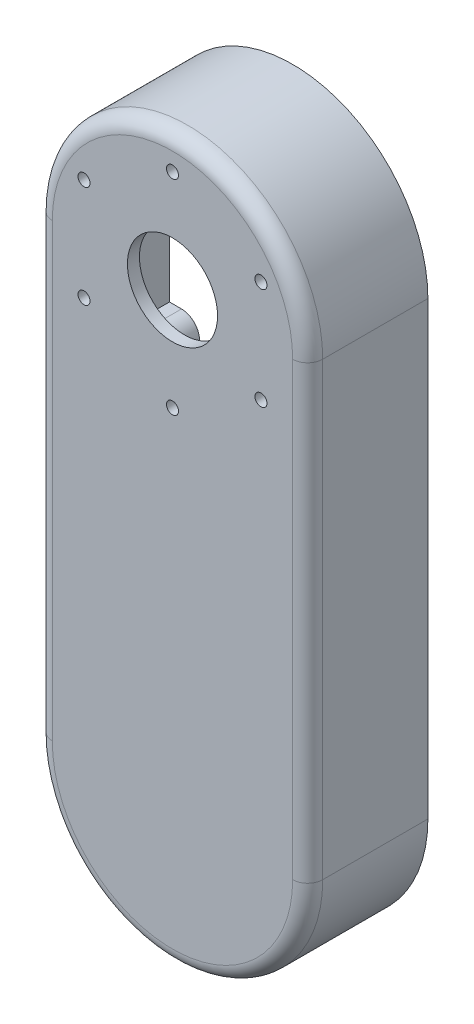
from build123d import *

# Parameters (mm, degrees)
ESBO_O1_R                = 2
ESBO_O1_R_2              = 15
RESSALTO_EXTRUS_O1_DEPTH = 40
CASCA1_T                 = -4
ESBO_O2_R                = 2
RESSALTO_EXTRUS_O3_DEPTH = 36
CORTE_EXTRUS_O2_DEPTH    = 4
RESSALTO_EXTRUS_O4_DEPTH = 4
FILETE1_START            = 49
FILETE1_DEPTH            = 6
FILETE1_START_2          = 50
FILETE1_2_DEPTH          = 4
PADR_O_LINEAR1_COUNT     = 2
PADR_O_LINEAR1_PITCH     = 40
CHANFRO1_SIZE            = 8
CHANFRO1_SIZE2           = 13.856406461
FILETE2_R                = 5


with BuildPart() as part:
    # Esboço1 → Ressalto-extrusão1 (new body)
    with BuildSketch(Plane.XY):
        with BuildLine():
            Line((-45, 150), (-45, 0))
            ThreePointArc((-45, 0), (0, -45), (45, 0))
            Line((45, 0), (45, 150))
            ThreePointArc((45, 150), (0, 195), (-45, 150))
        make_face()
        with Locations((0, 184)):
            Circle(ESBO_O1_R, mode=Mode.SUBTRACT)
        with Locations((29.444863729, 167)):
            Circle(ESBO_O1_R, mode=Mode.SUBTRACT)
        with Locations((29.444863729, 133)):
            Circle(ESBO_O1_R, mode=Mode.SUBTRACT)
        with Locations((0, 116)):
            Circle(ESBO_O1_R, mode=Mode.SUBTRACT)
        with Locations((-29.444863729, 133)):
            Circle(ESBO_O1_R, mode=Mode.SUBTRACT)
        with Locations((-29.444863729, 167)):
            Circle(ESBO_O1_R, mode=Mode.SUBTRACT)
        with Locations((0, 150)):
            Circle(ESBO_O1_R_2, mode=Mode.SUBTRACT)
    extrude(amount=RESSALTO_EXTRUS_O1_DEPTH)

    # Casca1
    casca1_openings = [part.faces().sort_by_distance(p)[0] for p in [
        (-2, 184, 20),
        (-15, 150, 20),
        (27.444863729, 167, 20),
        (27.444863729, 133, 20),
        (-2, 116, 20),
        (-31.444863729, 133, 20),
        (0, 71.925006446, 0),
        (-31.444863729, 167, 20),
    ]]
    offset(amount=CASCA1_T, openings=casca1_openings, kind=Kind.INTERSECTION)

    # Esboço2 → Ressalto-extrusão3 (add)
    # profile 1 of 12: a face of its own
    with BuildSketch(Plane(origin=(0, 0, 36), x_dir=(-1, 0, 0), z_dir=(0, 0, -1))):
        with BuildLine():
            Line((41.3, 156), (41.3, 144))
            Line((41.3, 144), (37, 144))
            ThreePointArc((37, 144), (31, 150), (37, 156))
            Line((37, 156), (41.3, 156))
        make_face()
        with Locations(Location((37, 150, 0), (0, 0, 180))):
            Circle(ESBO_O2_R, mode=Mode.SUBTRACT)
    # profile 2 of 12: a face of its own
    with BuildSketch(Plane(origin=(0, 0, 36), x_dir=(-1, 0, 0), z_dir=(0, 0, -1))):
        with BuildLine():
            Line((37, 94), (41.3, 94))
            Line((41.3, 94), (41.3, 106))
            Line((41.3, 106), (37, 106))
            ThreePointArc((37, 106), (31, 100), (37, 94))
        make_face()
        with Locations(Location((37, 100, 0), (0, 0, 180))):
            Circle(ESBO_O2_R, mode=Mode.SUBTRACT)
    # profile 3 of 12: a face of its own
    with BuildSketch(Plane(origin=(0, 0, 36), x_dir=(-1, 0, 0), z_dir=(0, 0, -1))):
        with BuildLine():
            Line((37, 44), (41.3, 44))
            Line((41.3, 44), (41.3, 56))
            Line((41.3, 56), (37, 56))
            ThreePointArc((37, 56), (31, 50), (37, 44))
        make_face()
        with Locations(Location((37, 50, 0), (0, 0, 180))):
            Circle(ESBO_O2_R, mode=Mode.SUBTRACT)
    # profile 4 of 12: a face of its own
    with BuildSketch(Plane(origin=(0, 0, 36), x_dir=(-1, 0, 0), z_dir=(0, 0, -1))):
        with BuildLine():
            Line((37, -6), (41.3, -6))
            Line((41.3, -6), (41.3, 6))
            Line((41.3, 6), (37, 6))
            ThreePointArc((37, 6), (31, 0), (37, -6))
        make_face()
        with Locations(Location((37, 0, 0), (0, 0, 180))):
            Circle(ESBO_O2_R, mode=Mode.SUBTRACT)
    # profile 5 of 12: a face of its own
    with BuildSketch(Plane(origin=(0, 0, 36), x_dir=(-1, 0, 0), z_dir=(0, 0, -1))):
        with BuildLine():
            Line((15.577697221, 184.434272947), (17.955996053, 187.650434427))
            Line((17.955996053, 187.650434427), (22.772975647, 184.454050272))
            Line((22.772975647, 184.454050272), (27.779304684, 180.751951801))
            Line((27.779304684, 180.751951801), (27.604480494, 180.515537933))
            Line((27.604480494, 180.515537933), (25.226181662, 177.299376452))
            ThreePointArc((25.226181662, 177.299376452), (16.834491194, 176.042582479), (15.577697221, 184.434272947))
        make_face()
        with Locations(Location((20.401939442, 180.866824699, 0), (0, 0, 180))):
            Circle(ESBO_O2_R, mode=Mode.SUBTRACT)
    # profile 6 of 12: a face of its own
    with BuildSketch(Plane(origin=(0, 0, 36), x_dir=(-1, 0, 0), z_dir=(0, 0, -1))):
        with BuildLine():
            Line((27.779304684, -30.751951801), (27.604480494, -30.515537933))
            Line((27.604480494, -30.515537933), (25.226181662, -27.299376452))
            ThreePointArc((25.226181662, -27.299376452), (16.834491194, -26.042582479), (15.577697221, -34.434272947))
            Line((15.577697221, -34.434272947), (17.955996053, -37.650434427))
            Line((17.955996053, -37.650434427), (22.772975647, -34.454050272))
            Line((22.772975647, -34.454050272), (27.779304684, -30.751951801))
        make_face()
        with Locations(Location((20.401939442, -30.866824699, 0), (0, 0, 180))):
            Circle(ESBO_O2_R, mode=Mode.SUBTRACT)
    # profile 7 of 12: a face of its own
    with BuildSketch(Plane(origin=(0, 0, 36), x_dir=(-1, 0, 0), z_dir=(0, 0, -1))):
        with BuildLine():
            Line((-15.577697221, -34.434272947), (-17.955996053, -37.650434427))
            Line((-17.955996053, -37.650434427), (-22.772975647, -34.454050272))
            Line((-22.772975647, -34.454050272), (-27.779304684, -30.751951801))
            Line((-27.779304684, -30.751951801), (-27.604480494, -30.515537933))
            Line((-27.604480494, -30.515537933), (-25.226181662, -27.299376452))
            ThreePointArc((-25.226181662, -27.299376452), (-16.834491194, -26.042582479), (-15.577697221, -34.434272947))
        make_face()
        with Locations(Location((-20.401939442, -30.866824699, 0), (0, 0, 180))):
            Circle(ESBO_O2_R, mode=Mode.SUBTRACT)
    # profile 8 of 12: a face of its own
    with BuildSketch(Plane(origin=(0, 0, 36), x_dir=(-1, 0, 0), z_dir=(0, 0, -1))):
        with BuildLine():
            Line((-27.779304684, 180.751951801), (-27.604480494, 180.515537933))
            Line((-27.604480494, 180.515537933), (-25.226181662, 177.299376452))
            ThreePointArc((-25.226181662, 177.299376452), (-16.834491194, 176.042582479), (-15.577697221, 184.434272947))
            Line((-15.577697221, 184.434272947), (-17.955996053, 187.650434427))
            Line((-17.955996053, 187.650434427), (-22.772975647, 184.454050272))
            Line((-22.772975647, 184.454050272), (-27.779304684, 180.751951801))
        make_face()
        with Locations(Location((-20.401939442, 180.866824699, 0), (0, 0, 180))):
            Circle(ESBO_O2_R, mode=Mode.SUBTRACT)
    # profile 9 of 12: a face of its own
    with BuildSketch(Plane(origin=(0, 0, 36), x_dir=(-1, 0, 0), z_dir=(0, 0, -1))):
        with BuildLine():
            Line((-41.3, 6), (-41.3, -6))
            Line((-41.3, -6), (-37, -6))
            ThreePointArc((-37, -6), (-31, 0), (-37, 6))
            Line((-37, 6), (-41.3, 6))
        make_face()
        with Locations(Location((-37, 0, 0), (0, 0, 180))):
            Circle(ESBO_O2_R, mode=Mode.SUBTRACT)
    # profile 10 of 12: a face of its own
    with BuildSketch(Plane(origin=(0, 0, 36), x_dir=(-1, 0, 0), z_dir=(0, 0, -1))):
        with BuildLine():
            Line((-41.3, 56), (-41.3, 44))
            Line((-41.3, 44), (-37, 44))
            ThreePointArc((-37, 44), (-31, 50), (-37, 56))
            Line((-37, 56), (-41.3, 56))
        make_face()
        with Locations(Location((-37, 50, 0), (0, 0, 180))):
            Circle(ESBO_O2_R, mode=Mode.SUBTRACT)
    # profile 11 of 12: a face of its own
    with BuildSketch(Plane(origin=(0, 0, 36), x_dir=(-1, 0, 0), z_dir=(0, 0, -1))):
        with BuildLine():
            Line((-41.3, 106), (-41.3, 94))
            Line((-41.3, 94), (-37, 94))
            ThreePointArc((-37, 94), (-31, 100), (-37, 106))
            Line((-37, 106), (-41.3, 106))
        make_face()
        with Locations(Location((-37, 100, 0), (0, 0, 180))):
            Circle(ESBO_O2_R, mode=Mode.SUBTRACT)
    # profile 12 of 12: a face of its own
    with BuildSketch(Plane(origin=(0, 0, 36), x_dir=(-1, 0, 0), z_dir=(0, 0, -1))):
        with BuildLine():
            Line((-37, 144), (-41.3, 144))
            Line((-41.3, 144), (-41.3, 156))
            Line((-41.3, 156), (-37, 156))
            ThreePointArc((-37, 156), (-31, 150), (-37, 144))
        make_face()
        with Locations(Location((-37, 150, 0), (0, 0, 180))):
            Circle(ESBO_O2_R, mode=Mode.SUBTRACT)
    extrude(amount=RESSALTO_EXTRUS_O3_DEPTH)

    # Esboço3 → Corte-extrusão2 (cut)
    with BuildSketch(Plane(origin=(0, 0, 10), x_dir=(-1, 0, 0), z_dir=(0, 0, -1))):
        Polygon((-39.25166605, 146.1), (-34.74833395, 146.1), (-31, 146.1), (-31, 153.9), (-34.74833395, 153.9), (-39.25166605, 153.9), (-41.5033321, 150), align=None)
        Polygon((-15.927398314, 181.375235656), (-18.604965682, 184.996096464), (-23.079506809, 184.487685507), (-24.876480569, 180.358413743), (-22.198913201, 176.737552935), (-19.955229405, 173.703430685), (-13.683714518, 178.341113406), align=None)
        Polygon((-39.25166605, 96.1), (-34.74833395, 96.1), (-31, 96.1), (-31, 103.9), (-34.74833395, 103.9), (-39.25166605, 103.9), (-41.5033321, 100), align=None)
        Polygon((-39.25166605, 46.1), (-34.74833395, 46.1), (-31, 46.1), (-31, 53.9), (-34.74833395, 53.9), (-39.25166605, 53.9), (-41.5033321, 50), align=None)
        Polygon((-39.25166605, -3.9), (-34.74833395, -3.9), (-31, -3.9), (-31, 3.9), (-34.74833395, 3.9), (-39.25166605, 3.9), (-41.5033321, 0), align=None)
        Polygon((-22.198913201, -26.737552935), (-19.955229405, -23.703430685), (-13.683714518, -28.341113406), (-15.927398314, -31.375235656), (-18.604965682, -34.996096464), (-23.079506809, -34.487685507), (-24.876480569, -30.358413743), align=None)
        Polygon((15.927398314, -31.375235656), (18.604965682, -34.996096464), (23.079506809, -34.487685507), (24.876480569, -30.358413743), (22.198913201, -26.737552935), (19.955229405, -23.703430685), (13.683714518, -28.341113406), align=None)
        Polygon((41.5033321, 0), (39.25166605, -3.9), (34.74833395, -3.9), (31, -3.9), (31, 3.9), (34.74833395, 3.9), (39.25166605, 3.9), align=None)
        Polygon((41.5033321, 50), (39.25166605, 46.1), (34.74833395, 46.1), (31, 46.1), (31, 53.9), (34.74833395, 53.9), (39.25166605, 53.9), align=None)
        Polygon((41.5033321, 100), (39.25166605, 96.1), (34.74833395, 96.1), (31, 96.1), (31, 103.9), (34.74833395, 103.9), (39.25166605, 103.9), align=None)
        Polygon((22.198913201, 176.737552935), (19.955229405, 173.703430685), (13.683714518, 178.341113406), (15.927398314, 181.375235656), (18.604965682, 184.996096464), (23.079506809, 184.487685507), (24.876480569, 180.358413743), align=None)
        Polygon((31, 146.1), (34.74833395, 146.1), (39.25166605, 146.1), (41.5033321, 150), (39.25166605, 153.9), (34.74833395, 153.9), (31, 153.9), align=None)
    extrude(amount=-CORTE_EXTRUS_O2_DEPTH, mode=Mode.SUBTRACT)

    # Esboço7 → Ressalto-extrusão4 (add)
    with BuildSketch(Plane(origin=(0, 50, 0), x_dir=(1, 0, 0), z_dir=(0, 1, 0))):
        Polygon((10, -36), (10, -34), (0, -34), (0, -32), (15, -32), (15, -36), align=None)
    ressalto_extrus_o4 = extrude(amount=RESSALTO_EXTRUS_O4_DEPTH)

    # Filete1: read off the stored shape, not the designer's step
    # Filete1 outline → Filete1 (cut)
    with BuildSketch(Plane(origin=(0, 0, 0), x_dir=(1, 0, 0), z_dir=(0, 1, 0)).offset(FILETE1_START)):
        with BuildLine():
            Line((0, -34), (1.5, -34))
            ThreePointArc((1.5, -34), (0.633974596, -33.724744871), (0.085786438, -33))
            ThreePointArc((0.085786438, -33), (0.633974596, -32.275255129), (1.5, -32))
            Line((1.5, -32), (0, -32))
            Line((0, -32), (0, -34))
        make_face()
        with BuildLine():
            ThreePointArc((13.5, -32), (14.560660172, -32.439339828), (15, -33.5))
            Line((15, -33.5), (15, -32))
            Line((15, -32), (13.5, -32))
        make_face()
    filete1 = extrude(amount=FILETE1_DEPTH, mode=Mode.SUBTRACT)

    # Filete1 2 outline → Filete1 2 (add)
    with BuildSketch(Plane(origin=(0, 0, 0), x_dir=(1, 0, 0), z_dir=(0, 1, 0)).offset(FILETE1_START_2)):
        with BuildLine():
            ThreePointArc((9.914213562, -35), (9.366025404, -35.724744871), (8.5, -36))
            Line((8.5, -36), (10, -36))
            Line((10, -36), (10, -34))
            Line((10, -34), (8.5, -34))
            ThreePointArc((8.5, -34), (9.366025404, -34.275255129), (9.914213562, -35))
        make_face()
        with BuildLine():
            Line((15, -34.5), (15, -36))
            Line((15, -36), (16.5, -36))
            ThreePointArc((16.5, -36), (15.439339828, -35.560660172), (15, -34.5))
        make_face()
    filete1_2 = extrude(amount=FILETE1_2_DEPTH)

    # Padrão linear1: Ressalto-extrusão4, Filete1, Filete1 2 ×2
    with Locations(*[(0, i * PADR_O_LINEAR1_PITCH, 0) for i in range(1, PADR_O_LINEAR1_COUNT)]):
        add(ressalto_extrus_o4)
        add(filete1, mode=Mode.SUBTRACT)
        add(filete1_2)

    # Chanfro1
    chanfro1_edges = [part.edges().sort_by_distance(p)[0] for p in [
        (-39, 56, 36),
        (-31, 50, 36),
        (-39, 44, 36),
        (-31, 0, 36),
        (-38.779299791, -6, 36),
        (-39, 6, 36),
        (-16.550858431, 185.750273928, 36),
        (-16.834491194, 176.042582479, 36),
        (-26.370944538, 178.847433499, 36),
        (-26.370944538, -28.847433499, 36),
        (-16.834491194, -26.042582479, 36),
        (-16.550858431, -35.750273928, 36),
        (16.550858431, -35.750273928, 36),
        (16.834491194, -26.042582479, 36),
        (26.370944538, -28.847433499, 36),
        (26.370944538, 178.847433499, 36),
        (16.834491194, 176.042582479, 36),
        (16.550858431, 185.750273928, 36),
        (31, 0, 36),
        (39, 6, 36),
        (38.779299791, -6, 36),
        (39, 44, 36),
        (31, 50, 36),
        (39, 56, 36),
        (39, 94, 36),
        (31, 100, 36),
        (39, 106, 36),
        (39, 144, 36),
        (31, 150, 36),
        (38.779299791, 156, 36),
        (-31, 150, 36),
        (-39, 144, 36),
        (-38.779299791, 156, 36),
        (-39, 106, 36),
        (-31, 100, 36),
        (-39, 94, 36),
    ]]
    chanfro1_side = [part.faces().sort_by_distance(p)[0] for p in [
        (-0.051644453, 71.224968447, 36),
    ]]
    chamfer(chanfro1_edges, length=CHANFRO1_SIZE, length2=CHANFRO1_SIZE2, reference=chanfro1_side[0])

    # Filete2
    filete2_edges = [part.edges().sort_by_distance(p)[0] for p in [
        (0, 195, 40),
        (-45, 75, 40),
        (0, -45, 40),
        (45, 75, 40),
    ]]
    fillet(filete2_edges, radius=FILETE2_R)


solid = part.part
